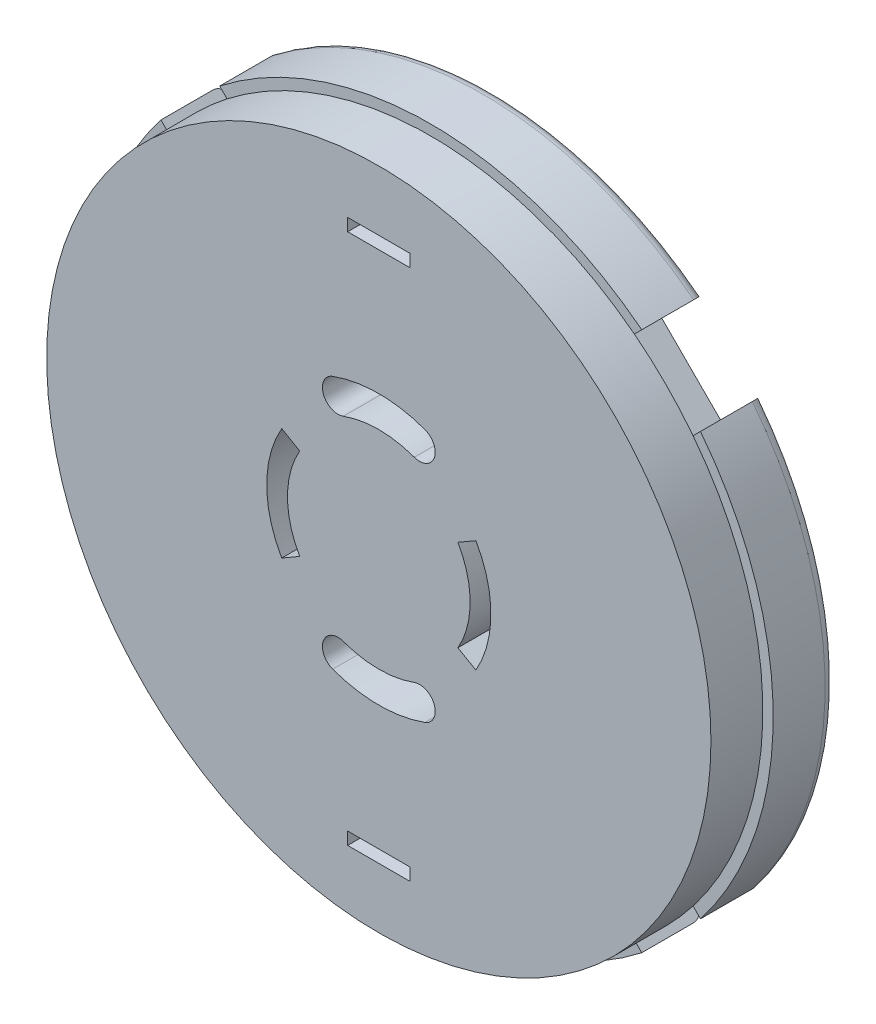
from build123d import *

# Parameters (mm, degrees)
SKETCH1_R           = 16.5
BOSS_EXTRUDE1_DEPTH = 3
SKETCH2_R           = 4.5
BOSS_EXTRUDE2_DEPTH = 2
CUT_EXTRUDE1_DEPTH  = 24.526580712
CIRPATTERN1_COUNT   = 4
SKETCH4_R           = 16
BOSS_EXTRUDE3_DEPTH = 2.5
CUT_EXTRUDE2_DEPTH  = 24.973944189
CIRPATTERN2_COUNT   = 2
CUT_EXTRUDE3_DEPTH  = 24.973944189
CIRPATTERN3_COUNT   = 2
SKETCH8_R           = 1.45
CUT_EXTRUDE4_DEPTH  = 0.5
SKETCH9_W           = 0.5
SKETCH9_H           = 2.9
EXTRUDE_THIN1_DEPTH = 0.5
SKETCH10_W          = 2.9
SKETCH10_H          = 0.5
EXTRUDE_THIN2_DEPTH = 0.5
SKETCH11_W          = 3
SKETCH11_H          = 0.6
CUT_EXTRUDE5_DEPTH  = 24.973944189
CIRPATTERN4_COUNT   = 2
FILLET1_R           = 0.1
FILLET2_R           = 0.5
SKETCH_1_R          = 1.5
EXTRUDE_1_DEPTH     = 2


with BuildPart() as part:
    # Sketch1 → Boss-Extrude1 (new body)
    with BuildSketch(Plane.XY):
        Circle(SKETCH1_R)
    extrude(amount=-BOSS_EXTRUDE1_DEPTH)

    # Sketch2 → Boss-Extrude2 (add)
    with BuildSketch(Plane(origin=(0, 0, -3), x_dir=(-1, 0, 0), z_dir=(0, 0, -1))):
        Circle(SKETCH2_R)
    extrude(amount=BOSS_EXTRUDE2_DEPTH)

    # Sketch3 → Cut-Extrude1 (cut, through all)
    with BuildSketch(Plane(origin=(0, 0, -3), x_dir=(-1, 0, 0), z_dir=(0, 0, -1))):
        Polygon((10.253048327, 13.081475452), (8.131727984, 10.960155108), (10.960155108, 8.131727984), (13.081475452, 10.253048327), align=None)
    cut_extrude1 = extrude(amount=-CUT_EXTRUDE1_DEPTH, mode=Mode.SUBTRACT)

    # CirPattern1: Cut-Extrude1 ×4 about axis
    cirpattern1_axis = Axis((0, 0, 0), (0, 0, 1))
    for i in range(1, CIRPATTERN1_COUNT):
        add(cut_extrude1.rotate(cirpattern1_axis, i * 360 / CIRPATTERN1_COUNT), mode=Mode.SUBTRACT)

    # Sketch4 → Boss-Extrude3 (add)
    with BuildSketch(Plane.XY):
        with Locations(Location((0, 0, 0), (0, 0, 217.819244219))):
            Circle(SKETCH4_R)
    extrude(amount=BOSS_EXTRUDE3_DEPTH)

    # Sketch6 → Cut-Extrude2 (cut, through all)
    with BuildSketch(Plane(origin=(0, 0, -3), x_dir=(-1, 0, 0), z_dir=(0, 0, -1))):
        with BuildLine():
            Line((-4.67653718, 2.7), (-3.810511777, 2.2))
            ThreePointArc((-3.810511777, 2.2), (-4.4, 0), (-3.810511777, -2.2))
            Line((-3.810511777, -2.2), (-4.67653718, -2.7))
            ThreePointArc((-4.67653718, -2.7), (-5.4, 0), (-4.67653718, 2.7))
        make_face()
    cut_extrude2 = extrude(amount=-CUT_EXTRUDE2_DEPTH, mode=Mode.SUBTRACT)

    # CirPattern2: Cut-Extrude2 ×2 about axis
    cirpattern2_axis = Axis((0, 0, 0), (0, 0, 1))
    for i in range(1, CIRPATTERN2_COUNT):
        add(cut_extrude2.rotate(cirpattern2_axis, i * 360 / CIRPATTERN2_COUNT), mode=Mode.SUBTRACT)

    # Sketch7 → Cut-Extrude3 (cut, through all)
    with BuildSketch(Plane(origin=(0, 0, -3), x_dir=(-1, 0, 0), z_dir=(0, 0, -1))):
        with BuildLine():
            ThreePointArc((2.223130932, 6.108002035), (0, 6.5), (-2.223130932, 6.108002035))
            ThreePointArc((-2.223130932, 6.108002035), (-2.67138529, 5.146717462), (-1.710100717, 4.698463104))
            ThreePointArc((-1.710100717, 4.698463104), (0, 5), (1.710100717, 4.698463104))
            ThreePointArc((1.710100717, 4.698463104), (2.67138529, 5.146717462), (2.223130932, 6.108002035))
        make_face()
    cut_extrude3 = extrude(amount=-CUT_EXTRUDE3_DEPTH, mode=Mode.SUBTRACT)

    # CirPattern3: Cut-Extrude3 ×2 about axis
    cirpattern3_axis = Axis((0, 0, 0), (0, 0, 1))
    for i in range(1, CIRPATTERN3_COUNT):
        add(cut_extrude3.rotate(cirpattern3_axis, i * 360 / CIRPATTERN3_COUNT), mode=Mode.SUBTRACT)

    # Sketch8 → Cut-Extrude4 (cut)
    with BuildSketch(Plane(origin=(0, 0, -3), x_dir=(-1, 0, 0), z_dir=(0, 0, -1))):
        with Locations((-7.071067812, 7.071067812)):
            Circle(SKETCH8_R)
        Polygon((8.485281374, -3.535533906), (3.535533906, -8.485281374), (5.656854249, -10.606601718), (10.606601718, -5.656854249), align=None)
    extrude(amount=-CUT_EXTRUDE4_DEPTH, mode=Mode.SUBTRACT)

    # Sketch9 → Extrude-Thin1 (add)
    with BuildSketch(Plane(origin=(0, 0, -2.5), x_dir=(-1, 0, 0), z_dir=(0, 0, -1))):
        with Locations((-7.071067812, 7.071067812)):
            Rectangle(SKETCH9_W, SKETCH9_H)
    extrude(amount=EXTRUDE_THIN1_DEPTH)

    # Sketch10 → Extrude-Thin2 (add)
    with BuildSketch(Plane(origin=(0, 0, -2.5), x_dir=(-1, 0, 0), z_dir=(0, 0, -1))):
        with Locations((-7.071067812, 7.071067812)):
            Rectangle(SKETCH10_W, SKETCH10_H)
    extrude(amount=EXTRUDE_THIN2_DEPTH)

    # Sketch11 → Cut-Extrude5 (cut, through all)
    with BuildSketch(Plane(origin=(0, 0, -3), x_dir=(-1, 0, 0), z_dir=(0, 0, -1))):
        with Locations((0, 12.8)):
            Rectangle(SKETCH11_W, SKETCH11_H)
    cut_extrude5 = extrude(amount=-CUT_EXTRUDE5_DEPTH, mode=Mode.SUBTRACT)

    # CirPattern4: Cut-Extrude5 ×2 about axis
    cirpattern4_axis = Axis((0, 0, 0), (0, 0, 1))
    for i in range(1, CIRPATTERN4_COUNT):
        add(cut_extrude5.rotate(cirpattern4_axis, i * 360 / CIRPATTERN4_COUNT), mode=Mode.SUBTRACT)

    # Fillet1
    # the kernel refuses this fillet: 0.1 mm, written as the material it adds along each edge
    with BuildSketch(Plane(origin=(0, 0, -3), x_dir=(0.86602540378442, -0.5000000000000324, 0), z_dir=(0.5000000000000324, 0.86602540378442, 0))) as fillet1_piece_1:
        with BuildLine():
            CenterArc((4.5 + FILLET1_R, FILLET1_R), FILLET1_R, 180, 90)
            Line((4.5, FILLET1_R), (4.5, 0))
            Line((4.5, 0), (4.5 + FILLET1_R, 0))
        make_face()
    revolve(axis=Axis((0, 0, -3), (0, 0, -1)), revolution_arc=120)
    with BuildSketch(Plane(origin=(0, 0, -3), x_dir=(-0.8660254037844196, 0.500000000000033, 0), z_dir=(-0.500000000000033, -0.8660254037844196, 0))) as fillet1_piece_2:
        with BuildLine():
            CenterArc((4.5 + FILLET1_R, FILLET1_R), FILLET1_R, 180, 90)
            Line((4.5, FILLET1_R), (4.5, 0))
            Line((4.5, 0), (4.5 + FILLET1_R, 0))
        make_face()
    revolve(axis=Axis((0, 0, -3), (0, 0, -1)), revolution_arc=120)
    # the kernel refuses this fillet: 0.1 mm, written as the material it takes off along each edge
    with BuildSketch(Plane(origin=(0, 0, -5), x_dir=(-1, 0, 0), z_dir=(0, -1, 0))) as fillet1_2_piece_1:
        with BuildLine():
            CenterArc((4.5 - FILLET1_R, -FILLET1_R), FILLET1_R, 0, 90)
            Line((4.5 - FILLET1_R, 0), (4.5, 0))
            Line((4.5, 0), (4.5, -FILLET1_R))
        make_face()
    revolve(axis=Axis((0, 0, -5), (0, 0, -1)), mode=Mode.SUBTRACT)

    # Fillet2
    fillet2_edges = [part.edges().sort_by_distance(p)[0] for p in [
        (-16.5, 0, -3),
        (0, -16.5, -3),
        (16.5, 0, -3),
        (0, 16.5, -3),
    ]]
    fillet(fillet2_edges, radius=FILLET2_R)

    # Эскиз1 → Бобышка-Вытянуть1 (add)
    with BuildSketch(Plane(origin=(0, 0, -5), x_dir=(-1, 0, 0), z_dir=(0, 0, -1))):
        Circle(SKETCH_1_R)
    extrude(amount=EXTRUDE_1_DEPTH)


solid = part.part
